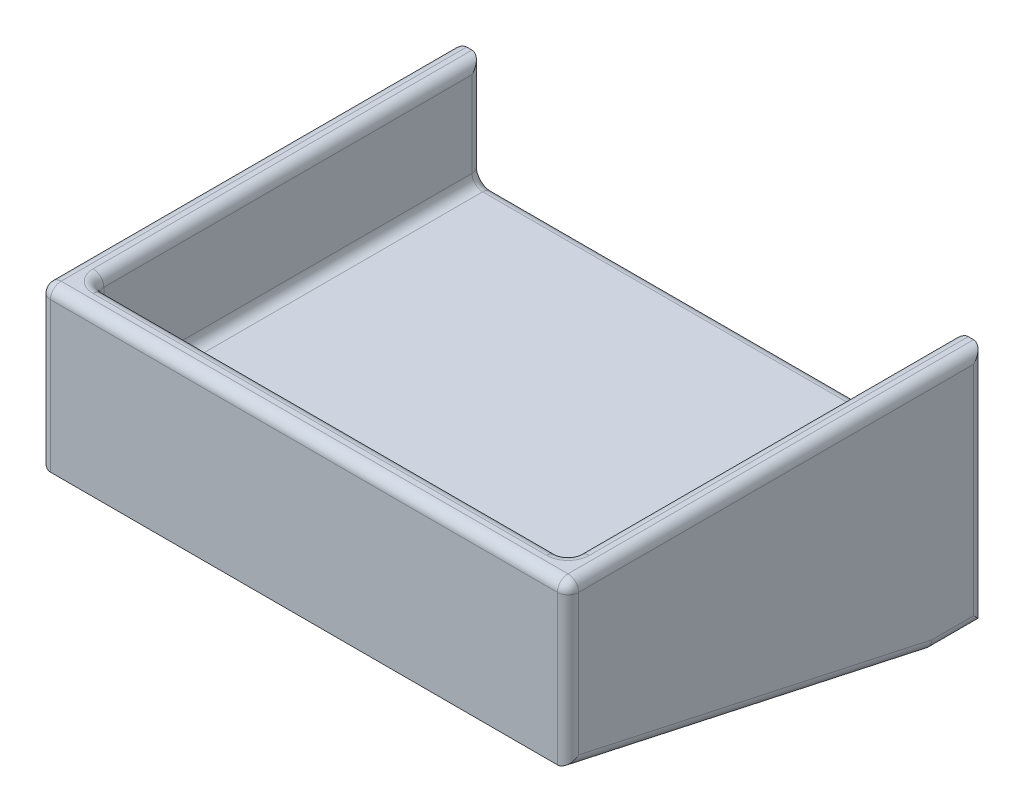
from build123d import *

# Parameters (mm, degrees)
BOSS_EXTRUDE1_DEPTH    = 7.5
BOSS_EXTRUDE2_START    = -7.5
SKETCH1_3_W            = 44.5
SKETCH1_3_H            = 36.5
BOSS_EXTRUDE2_DEPTH    = 5
BOSS_EXTRUDE3_DEPTH    = 2.5
BOSS_EXTRUDE4_DEPTH    = 5
CUT_EXTRUDE1_START     = -5
CUT_EXTRUDE1_DEPTH     = 3
M2_5_CLEARANCE_HOLE1_D = 2.9
MIRROR1_START          = -16.25
MIRROR1_DEPTH          = 3
MIRROR1_START_2        = -18.25
MIRROR1_2_OUTLINE_R    = 1.45
MIRROR1_2_DEPTH        = 2
MIRROR1_3_DEPTH        = 3
MIRROR1_START_3        = 22.25
MIRROR1_4_DEPTH        = 2.5
FILLET1_R              = 1
FILLET2_R              = 1
FILLET6_R              = 1
FILLET7_R              = 1
FILLET8_R              = 1


with BuildPart() as part:
    # Sketch1 → Boss-Extrude1 (new, symmetric)
    with BuildSketch(Plane(origin=(0, 0, 0), x_dir=(1, 0, 0), z_dir=(0, 1, 0))):
        Polygon((22.25, -18.25), (-22.25, -18.25), (-22.25, 18.25), (-24.75, 18.25), (-24.75, -20.75), (24.75, -20.75), (24.75, 18.25), (22.25, 18.25), align=None)
    extrude(amount=BOSS_EXTRUDE1_DEPTH, both=True)

    # Sketch1<3> → Boss-Extrude2 (add)
    with BuildSketch(Plane(origin=(0, 0, 0), x_dir=(1, 0, 0), z_dir=(0, 1, 0)).offset(BOSS_EXTRUDE2_START)):
        Rectangle(SKETCH1_3_W, SKETCH1_3_H)
    extrude(amount=BOSS_EXTRUDE2_DEPTH)

    # Sketch5 → Boss-Extrude3 (add)
    with BuildSketch(Plane(origin=(-24.75, 32.25, 0), x_dir=(0, 1, 0), z_dir=(-1, 0, 0))):
        Polygon((-47.15, 18.25), (-39.75, 18.25), (-39.75, -20.75), (-47.15, 13.25), align=None)
    extrude(amount=-BOSS_EXTRUDE3_DEPTH)

    # Sketch6 → Boss-Extrude4 (add)
    with BuildSketch(Plane(origin=(0, 0, -18.25), x_dir=(-1, 0, 0), z_dir=(0, 0, -1))):
        Polygon((-12.75, -10.3), (-14.266838493, -10.3), (-15.883419246, -13.1), (-19.116580754, -13.1), (-20.733161507, -10.3), (-19.116580754, -7.5), (-22.25, -7.5), (-22.25, -14.9), (-12.75, -14.9), align=None)
        Polygon((22.25, -7.5), (12.75, -7.5), (12.75, -10.3), (12.75, -14.9), (22.25, -14.9), align=None)
    extrude(amount=-BOSS_EXTRUDE4_DEPTH)

    # Sketch6<3> → Cut-Extrude1 (cut)
    with BuildSketch(Plane(origin=(0, 0, -18.25), x_dir=(-1, 0, 0), z_dir=(0, 0, -1)).offset(CUT_EXTRUDE1_START)):
        Polygon((19.0011107, -7.7), (15.9988893, -7.7), (14.4977786, -10.3), (15.9988893, -12.9), (19.0011107, -12.9), (20.5022214, -10.3), align=None)
    extrude(amount=CUT_EXTRUDE1_DEPTH, mode=Mode.SUBTRACT)

    # M2.5 Clearance Hole1 (through all)
    with Locations(Plane.XY.offset(-16.25)):
        with Locations((-17.5, -10.3), (17.5, -10.3)):
            Hole(M2_5_CLEARANCE_HOLE1_D / 2)

    # Mirror1: read off the stored shape, not the designer's step
    # Mirror1 outline → Mirror1 (cut)
    with BuildSketch(Plane.XY.offset(MIRROR1_START)):
        Polygon((-14.266838493, -10.3), (-15.883419246, -7.5), (-19.116580754, -7.5), (-20.733161507, -10.3), (-19.116580754, -13.1), (-15.883419246, -13.1), align=None)
        Polygon((-15.9988893, -12.9), (-19.0011107, -12.9), (-20.5022214, -10.3), (-19.0011107, -7.7), (-15.9988893, -7.7), (-14.4977786, -10.3), align=None, mode=Mode.SUBTRACT)
    extrude(amount=MIRROR1_DEPTH, mode=Mode.SUBTRACT)

    # Mirror1 2 outline → Mirror1 2 (add)
    with BuildSketch(Plane.XY.offset(MIRROR1_START_2)):
        Polygon((20.733161507, -10.3), (19.116580754, -7.5), (12.75, -7.5), (12.75, -10.3), (14.266838493, -10.3), (15.883419246, -13.1), (19.116580754, -13.1), align=None)
        with Locations((17.5, -10.3)):
            Circle(MIRROR1_2_OUTLINE_R, mode=Mode.SUBTRACT)
    extrude(amount=MIRROR1_2_DEPTH)

    # Mirror1 3 outline → Mirror1 3 (add)
    with BuildSketch(Plane.XY.offset(MIRROR1_START)):
        Polygon((20.733161507, -10.3), (19.116580754, -7.5), (12.75, -7.5), (12.75, -10.3), (14.266838493, -10.3), (15.883419246, -13.1), (19.116580754, -13.1), align=None)
        Polygon((15.9988893, -7.7), (19.0011107, -7.7), (20.5022214, -10.3), (19.0011107, -12.9), (15.9988893, -12.9), (14.4977786, -10.3), align=None, mode=Mode.SUBTRACT)
    extrude(amount=MIRROR1_3_DEPTH)

    # Mirror1 4 outline → Mirror1 4 (add)
    with BuildSketch(Plane.YZ.offset(MIRROR1_START_3)):
        Polygon((-14.9, -13.25), (-14.9, -18.25), (-7.5, -18.25), (-7.5, 20.75), align=None)
    extrude(amount=MIRROR1_4_DEPTH)

    # Fillet1
    fillet1_edges = [part.edges().sort_by_distance(p)[0] for p in [
        (22.25, 7.5, 0),
        (-22.25, 2.5, -18.25),
        (-22.25, 2.5, 18.25),
        (22.25, 2.5, 18.25),
        (22.25, 2.5, -18.25),
        (0, 7.5, 18.25),
        (-22.25, 7.5, 0),
        (-22.25, -2.5, 0),
        (0, -2.5, -18.25),
        (0, -2.5, 18.25),
        (22.25, -2.5, 0),
    ]]
    fillet(fillet1_edges, radius=FILLET1_R)

    # Fillet2
    fillet2_edges = [part.edges().sort_by_distance(p)[0] for p in [
        (24.75, -14.9, -15.75),
        (24.75, -11.2, 3.75),
        (24.75, 0, 20.75),
        (-24.75, 0, 20.75),
        (-24.75, -3.7, -18.25),
        (24.75, -3.7, -18.25),
        (-24.75, 7.5, 1.25),
        (-24.75, -14.9, -15.75),
        (-24.75, -11.2, 3.75),
        (24.75, 7.5, 1.25),
    ]]
    fillet(fillet2_edges, radius=FILLET2_R)

    # Fillet6
    fillet6_edges = [part.edges().sort_by_distance(p)[0] for p in [
        (-12.75, -14.9, -15.75),
        (12.75, -14.9, -15.75),
        (12.75, -11.2, -13.25),
    ]]
    fillet(fillet6_edges, radius=FILLET6_R)

    # Fillet7
    # the kernel refuses this fillet: 1 mm, written as the material it takes off along each edge
    with BuildSketch(Plane(origin=(23.75, 6.5, 19.75), x_dir=(0, 0, 1), z_dir=(0, 1, 0))) as fillet7_piece_1_section:
        Polygon((0, 0), (FILLET7_R, 0), (FILLET7_R, FILLET7_R), (0, FILLET7_R), align=None)
    fillet7_piece_1 = extrude(amount=FILLET7_R, mode=Mode.PRIVATE)
    fillet7_piece_1 = fillet7_piece_1 - Plane(origin=(23.75, 6.5, 19.75), x_dir=(-0.7071067811865476, 0, -0.7071067811865475), z_dir=(0, 1, 0)) * Sphere(FILLET7_R, mode=Mode.PRIVATE)
    add(fillet7_piece_1, mode=Mode.SUBTRACT)
    with BuildSketch(Plane(origin=(-23.75, 6.5, 19.75), x_dir=(0, 0, 1), z_dir=(0, 1, 0))) as fillet7_piece_2_section:
        Polygon((0, 0), (FILLET7_R, 0), (FILLET7_R, -FILLET7_R), (0, -FILLET7_R), align=None)
    fillet7_piece_2 = extrude(amount=FILLET7_R, mode=Mode.PRIVATE)
    fillet7_piece_2 = fillet7_piece_2 - Plane(origin=(-23.75, 6.5, 19.75), x_dir=(0.7071067811865475, 0, -0.7071067811865475), z_dir=(0, 1, 0)) * Sphere(FILLET7_R, mode=Mode.PRIVATE)
    add(fillet7_piece_2, mode=Mode.SUBTRACT)
    with BuildSketch(Plane(origin=(-23.75, 7.5, 20.75), x_dir=(0, 0, -1), z_dir=(1, 0, 0))) as fillet7_piece_3:
        with BuildLine():
            CenterArc((FILLET7_R, -FILLET7_R), FILLET7_R, 90, 90)
            Line((0, -FILLET7_R), (0, 0))
            Line((0, 0), (FILLET7_R, 0))
        make_face()
    extrude(amount=47.5, mode=Mode.SUBTRACT)

    # Fillet8
    fillet8_edges = [part.edges().sort_by_distance(p)[0] for p in [
        (22.25, -11.2, 3.75),
        (-22.25, -11.2, 3.75),
    ]]
    fillet(fillet8_edges, radius=FILLET8_R)


solid = part.part
